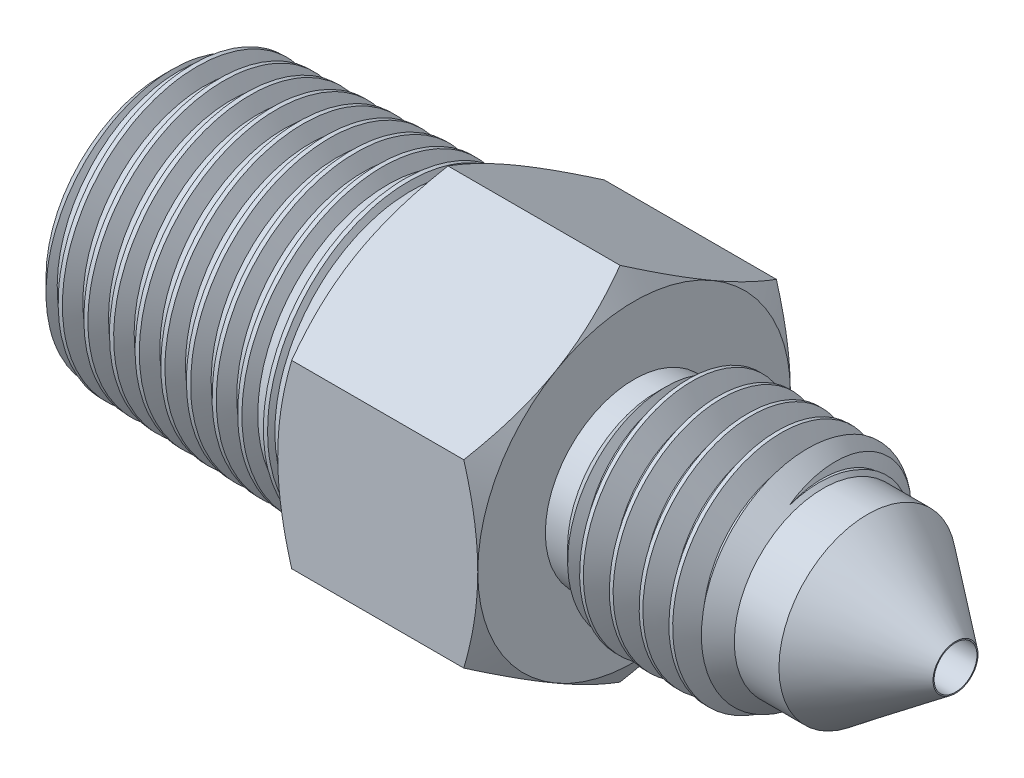
from build123d import *

# Parameters (mm, degrees)
SKETCH6_W              = 28.194
SKETCH6_H              = 3.96875
CUT_SWEEP1_PITCH       = 1.058333333
CUT_SWEEP1_TO          = 11.43
EXTRUDE1_DEPTH         = 7.112
SKETCH7_W              = 28.194
SKETCH7_H              = 0.762
SKETCH17_R             = 3.96875
CUT_EXTRUDE1_DEPTH     = 9.652
SKETCH19_R             = 5.1435
BOSS_EXTRUDE1_DEPTH    = 9.652
BOSS_EXTRUDE1_DRAFT    = -1.75
CHAMFER1_SIZE          = 0.705555556
CHAMFER1_SIZE2         = 0.728131207
CUT_SWEEP2_PITCH       = 0.941179716
CUT_SWEEP2_HEIGHT      = 10.592740741
CUT_SWEEP2_RADIUS      = 4.848604729
CUT_SWEEP2_START_ANGLE = -90
SKETCH22_R             = 5.1435
BOSS_EXTRUDE3_DEPTH    = 9.652
BOSS_EXTRUDE3_DRAFT    = -15
SKETCH23_R             = 2.413
CUT_EXTRUDE2_DEPTH     = 9.652


with BuildPart() as part:
    # Sketch6 → Revolve3 (revolve)
    with BuildSketch(Plane.XY, mode=Mode.PRIVATE) as revolve3_sk:
        with Locations((0, 1.984375)):
            Rectangle(SKETCH6_W, SKETCH6_H)
    revolve(revolve3_sk.sketch.rotate(Axis((-14.097, 0, 0), (1, 0, 0)), 90), axis=Axis((-14.097, 0, 0), (1, 0, 0)))

    # Cut-Sweep1: arcs per turn and ends read off the stored shape
    # Cut-Sweep1: the profile of Sketch15 profile screwed along a right-hand helix through 12.8 turns, 8 arcs to a turn; built about Z, then put on its axis
    cut_sweep1_z = Axis((0, 0, 0), (0, 0, 1))
    cut_sweep1_corners = [(3.96905, 0, -1.058160128), (3.96905, 0, -1.984548205), (3.281342336, 0, -1.5875), (3.281342336, 0, -1.455208333)]
    with BuildLine(mode=Mode.PRIVATE) as cut_sweep1_profile:
        Line(cut_sweep1_corners[0], cut_sweep1_corners[1])
        Line(cut_sweep1_corners[1], cut_sweep1_corners[2])
        Line(cut_sweep1_corners[2], cut_sweep1_corners[3])
        Line(cut_sweep1_corners[3], cut_sweep1_corners[0])
    cut_sweep1_cap = Face(cut_sweep1_profile.wire())
    cut_sweep1_turn_angles = [0, 22.5, 45, 67.5, 90, 112.5, 135, 157.5, 180, 202.5, 225, 247.5, 270, 292.5, 315, 337.5, 360]
    cut_sweep1_turn_weights = [1, 0.9238795325112867, 1, 0.9238795325112867, 1, 0.9238795325112867, 1, 0.9238795325112867, 1, 0.9238795325112867, 1, 0.9238795325112867, 1, 0.9238795325112867, 1, 0.9238795325112867, 1]
    cut_sweep1_turn_rails = [Edge.make_bspline([Vector(p[0], p[1], 0).rotate(cut_sweep1_z, cut_sweep1_turn_angles[k]) / cut_sweep1_turn_weights[k] + Vector(0, 0, p[2] + CUT_SWEEP1_PITCH * cut_sweep1_turn_angles[k] / 360) for k in range(17)], [0, 0, 0, 1, 1, 2, 2, 3, 3, 4, 4, 5, 5, 6, 6, 7, 7, 8, 8, 8], 2, cut_sweep1_turn_weights) for p in cut_sweep1_corners]
    cut_sweep1_turn_sides = [Face.make_surface_from_curves(cut_sweep1_turn_rails[p[0]], cut_sweep1_turn_rails[p[1]]) for p in [(0, 1), (1, 2), (2, 3), (3, 0)]]
    cut_sweep1_last_angles = [4320, 4342.5, 4365, 4387.5, 4410, 4432.5, 4455, 4477.5, 4500, 4522.5, 4545, 4567.5, 4590, 4599, 4608]
    cut_sweep1_last_weights = [1, 0.9238795325112867, 1, 0.9238795325112867, 1, 0.9238795325112867, 1, 0.9238795325112867, 1, 0.9238795325112867, 1, 0.9238795325112867, 1, 0.9876883405951378, 1]
    cut_sweep1_last_rails = [Edge.make_bspline([Vector(p[0], p[1], 0).rotate(cut_sweep1_z, cut_sweep1_last_angles[k]) / cut_sweep1_last_weights[k] + Vector(0, 0, p[2] + CUT_SWEEP1_PITCH * cut_sweep1_last_angles[k] / 360) for k in range(15)], [0, 0, 0, 1, 1, 2, 2, 3, 3, 4, 4, 5, 5, 6, 6, 7, 7, 7], 2, cut_sweep1_last_weights) for p in cut_sweep1_corners]
    cut_sweep1_last_sides = [Face.make_surface_from_curves(cut_sweep1_last_rails[p[0]], cut_sweep1_last_rails[p[1]]) for p in [(0, 1), (1, 2), (2, 3), (3, 0)]]
    cut_sweep1 = Plane(origin=(14.097, 0, 0), x_dir=(0, 1, 0), z_dir=(-1, 0, 0)) * split(Solid(Shell([*[p.moved(Location((0, 0, CUT_SWEEP1_PITCH * i))) for i in range(12) for p in cut_sweep1_turn_sides], *cut_sweep1_last_sides, cut_sweep1_cap, cut_sweep1_cap.rotate(cut_sweep1_z, 4608).moved(Location((0, 0, CUT_SWEEP1_PITCH * 4608 / 360)))])), bisect_by=Plane.XY.offset(CUT_SWEEP1_TO), keep=Keep.BOTTOM, mode=Mode.PRIVATE)
    add(cut_sweep1, mode=Mode.SUBTRACT)

    # Sketch12 → Extrude1 (add)
    with BuildSketch(Plane(origin=(-4.445, 0, 0), x_dir=(0, 0, -1), z_dir=(1, 0, 0))):
        Polygon((0, 6.415804866), (-5.55625, 3.207902433), (-5.55625, -3.207902433), (0, -6.415804866), (5.55625, -3.207902433), (5.55625, 3.207902433), align=None)
    extrude(amount=EXTRUDE1_DEPTH)

    # Sketch10 → Cut-Revolve6 (revolve, cut)
    with BuildSketch(Plane.XY, mode=Mode.PRIVATE) as cut_revolve6_sk:
        Polygon((4.275157664, 3.96875), (2.667, 3.96875), (2.667, 3.154342336), (3.46075, 3.154342336), align=None)
        Polygon((14.097, 3.96875), (8.570907235, 3.96875), (9.3853149, 3.154342336), (10.9728149, 3.154342336), (14.097, 0.8001), align=None)
    revolve(cut_revolve6_sk.sketch.rotate(Axis((-14.097, 0, 0), (1, 0, 0)), 90), axis=Axis((-14.097, 0, 0), (1, 0, 0)), mode=Mode.SUBTRACT)

    # Sketch7 → Cut-Revolve5 (revolve, cut)
    with BuildSketch(Plane.XY, mode=Mode.PRIVATE) as cut_revolve5_sk:
        with Locations((0, 0.381)):
            Rectangle(SKETCH7_W, SKETCH7_H)
    revolve(cut_revolve5_sk.sketch.rotate(Axis((14.097, 0, 0), (-1, 0, 0)), 101.193898112), axis=Axis((14.097, 0, 0), (-1, 0, 0)), mode=Mode.SUBTRACT)

    # Sketch13 → Cut-Revolve7 (revolve, cut)
    with BuildSketch(Plane.XY, mode=Mode.PRIVATE) as cut_revolve7_sk:
        Polygon((-4.445, 6.415804866), (-4.445, 5.55625), (-3.948735767, 6.415804866), align=None)
        Polygon((2.170735767, 6.415804866), (2.667, 5.55625), (2.667, 6.415804866), align=None)
    revolve(cut_revolve7_sk.sketch.rotate(Axis((-14.097, 0, 0), (1, 0, 0)), 258.806101888), axis=Axis((-14.097, 0, 0), (1, 0, 0)), mode=Mode.SUBTRACT)

    # Sketch17 → Cut-Extrude1 (cut)
    with BuildSketch(Plane.ZY.offset(14.097)):
        Circle(SKETCH17_R)
    extrude(amount=-CUT_EXTRUDE1_DEPTH, mode=Mode.SUBTRACT)


with BuildPart() as body_2:
    # Sketch19 → Boss-Extrude1 (with draft: the straight prism first)
    with BuildSketch(Plane(origin=(-4.445, 0, 0), x_dir=(0, 0, -1), z_dir=(1, 0, 0))):
        Circle(SKETCH19_R)
    extrude(amount=-BOSS_EXTRUDE1_DEPTH)
    # Boss-Extrude1: the draft: its side faces are tilted about the plane it starts from
    boss_extrude1_sides = [body_2.faces().sort_by_distance(p)[0] for p in [
        (-9.271, 0, 5.1435),
    ]]
    draft(boss_extrude1_sides, Plane(origin=(-4.445, 0, 0), x_dir=(0, 0, -1), z_dir=(1, 0, 0)), BOSS_EXTRUDE1_DRAFT)

    # Chamfer1
    chamfer1_edges = [body_2.edges().sort_by_distance(p)[0] for p in [
        (-14.097, 0, 4.848604729),
    ]]
    chamfer1_side = [body_2.faces().sort_by_distance(p)[0] for p in [
        (-14.097, 0, 0),
    ]]
    chamfer(chamfer1_edges, length=CHAMFER1_SIZE, length2=CHAMFER1_SIZE2, reference=chamfer1_side[0])

    # Cut-Sweep2: sweep along a helix
    with BuildLine() as cut_sweep2_path:
        # a taper helix: rise per turn along the axis 0.940740741, along the cone's slant (build123d's pitch) 0.941179716
        add(Helix(CUT_SWEEP2_PITCH, CUT_SWEEP2_HEIGHT, CUT_SWEEP2_RADIUS, center=(-14.097, 0, 0), direction=(1, 0, 0), cone_angle=1.75, mode=Mode.PRIVATE).rotate(Axis((-14.097, 0, 0), (1, 0, 0)), CUT_SWEEP2_START_ANGLE))
    # Sketch21 → Cut-Sweep2 (sweep, cut)
    with BuildSketch(Plane.XY):
        Polygon((-14.618136773, 4.362058532), (-14.377907578, 4.362058532), (-14.027651805, 4.968719326), (-14.89904435, 4.848604729), align=None)
    sweep(path=cut_sweep2_path.line, is_frenet=True, mode=Mode.SUBTRACT)


with BuildPart() as boss_extrude3_tool:
    # Sketch22 → Boss-Extrude3 (with draft: the straight prism first)
    with BuildSketch(Plane(origin=(-4.445, 0, 0), x_dir=(0, 0, -1), z_dir=(1, 0, 0))):
        Circle(SKETCH22_R)
    extrude(amount=-BOSS_EXTRUDE3_DEPTH)
    # Boss-Extrude3: the draft: its side faces are tilted about the plane it starts from
    boss_extrude3_sides = [boss_extrude3_tool.faces().sort_by_distance(p)[0] for p in [
        (-9.271, 0, 5.1435),
    ]]
    draft(boss_extrude3_sides, Plane(origin=(-4.445, 0, 0), x_dir=(0, 0, -1), z_dir=(1, 0, 0)), BOSS_EXTRUDE3_DRAFT)


with BuildPart() as body_2_1:
    add(body_2.part)

    # Boss-Extrude3: add boss_extrude3_tool
    add(boss_extrude3_tool.part)

    # Combine1: union part
    add(part.part)

    # Sketch23 → Cut-Extrude2 (cut)
    with BuildSketch(Plane.ZY.offset(14.097)):
        Circle(SKETCH23_R)
    extrude(amount=-CUT_EXTRUDE2_DEPTH, mode=Mode.SUBTRACT)


solid = body_2_1.part
